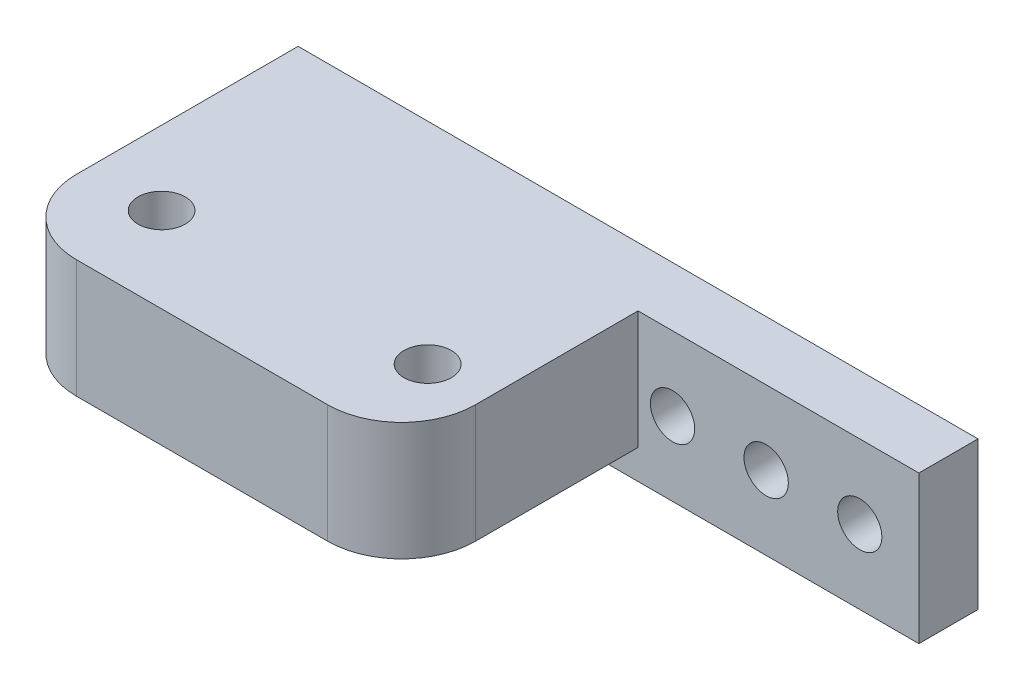
from build123d import *

# Parameters (mm, degrees)
SKETCH1_W           = 46
SKETCH1_H           = 10
BOSS_EXTRUDE1_DEPTH = 4
SKETCH4_W           = 27
SKETCH4_H           = 8
BOSS_EXTRUDE2_DEPTH = 16
SKETCH5_R           = 1.600993429
SKETCH5_R_2         = 1.598160281
CUT_EXTRUDE2_DEPTH  = 16
SKETCH6_R           = 1.494820838
SKETCH6_R_2         = 1.5
CUT_EXTRUDE3_DEPTH  = 16
FILLET1_R           = 5


with BuildPart() as part:
    # Sketch1 → Boss-Extrude1 (new body)
    with BuildSketch(Plane.XY):
        with Locations((23, 5)):
            Rectangle(SKETCH1_W, SKETCH1_H)
    extrude(amount=BOSS_EXTRUDE1_DEPTH)

    # Sketch4 → Boss-Extrude2 (add)
    with BuildSketch(Plane.XY.offset(4)):
        with Locations((13.5, 6)):
            Rectangle(SKETCH4_W, SKETCH4_H)
    extrude(amount=BOSS_EXTRUDE2_DEPTH)

    # Sketch5 → Cut-Extrude2 (cut)
    with BuildSketch(Plane.XZ.offset(-2)):
        with Locations((22.999560123, 14.235930167)):
            Circle(SKETCH5_R)
        with Locations((5.001441553, 14.237615424)):
            Circle(SKETCH5_R_2)
    extrude(amount=-CUT_EXTRUDE2_DEPTH, mode=Mode.SUBTRACT)

    # Sketch6 → Cut-Extrude3 (cut)
    with BuildSketch(Plane(origin=(0, 0, 0), x_dir=(-1, 0, 0), z_dir=(0, 0, -1))):
        with Locations((-42, 5)):
            Circle(SKETCH6_R)
        with Locations((-29.333333333, 5)):
            Circle(SKETCH6_R_2)
        with Locations((-35.666666667, 5)):
            Circle(SKETCH6_R_2)
    extrude(amount=-CUT_EXTRUDE3_DEPTH, mode=Mode.SUBTRACT)

    # Fillet1
    fillet1_edges = [part.edges().sort_by_distance(p)[0] for p in [
        (27, 6, 20),
        (0, 6, 20),
    ]]
    fillet(fillet1_edges, radius=FILLET1_R)


solid = part.part
